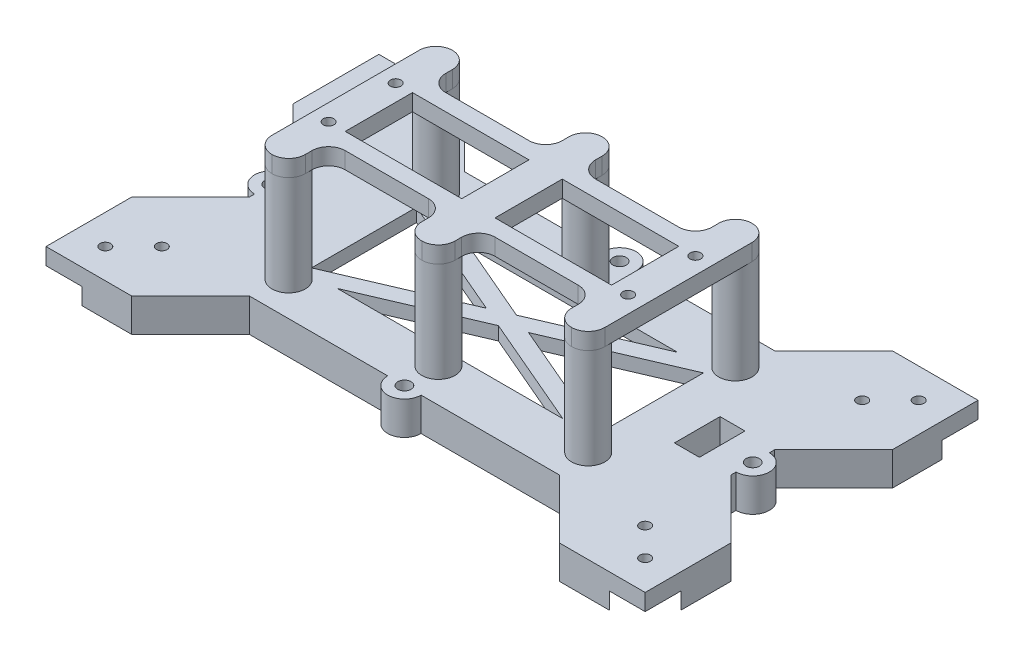
from build123d import *

# Parameters (mm, degrees)
SKETCH_1_W           = 90
SKETCH_1_H           = 50
EXTRUDE_1_DEPTH      = 10
CUT_EXTRUDE_2_DEPTH  = 5
SKETCH_7_R           = 1.6
CUT_EXTRUDE_3_DEPTH  = 10
MIRROR_3_DEPTH       = 10
MIRROR_START         = 5
MIRROR_3_2_OUTLINE_R = 1.6
MIRROR_3_2_DEPTH     = 5
SKETCH_8_R           = 5
EXTRUDE_2_DEPTH      = 30
SKETCH_10_W          = 35
SKETCH_10_H          = 20.2
EXTRUDE_6_DEPTH      = 5
SKETCH_11_W          = 102.2
SKETCH_11_H          = 51.5
CUT_EXTRUDE_4_DEPTH  = 6
SKETCH_12_W          = 7.5
SKETCH_12_H          = 13.7
CUT_EXTRUDE_5_DEPTH  = 50
FILLET_2_R           = 5
CUT_EXTRUDE_6_DEPTH  = 15
CUT_EXTRUDE_7_DEPTH  = 10
SKETCH_15_R          = 5
EXTRUDE_7_DEPTH      = 10
SKETCH_16_R          = 2
CUT_EXTRUDE_8_DEPTH  = 10
SKETCH_17_R          = 1.6
CUT_EXTRUDE_9_DEPTH  = 10


# Read off the part's stored shape, not the designer's step: Зеркальное отражение3
with BuildPart() as part:
    # Эскиз1 → Бобышка-Вытянуть1 (new body)
    with BuildSketch(Plane(origin=(0, 0, 0), x_dir=(1, 0, 0), z_dir=(0, 1, 0))):
        with Locations((4.158751696, -0.305291723)):
            Rectangle(SKETCH_1_W, SKETCH_1_H)
    extrude(amount=EXTRUDE_1_DEPTH)

    # Эскиз2 → Вырез-Вытянуть2 (cut)
    with BuildSketch(Plane.XZ):
        Polygon((-40.841248304, 14.557268649), (-23.163578774, -3.12040088), (-12.4155557, 7.627622194), (-30.09322523, 25.305291723), (-40.841248304, 25.305291723), align=None)
    extrude(amount=-CUT_EXTRUDE_2_DEPTH, mode=Mode.SUBTRACT)

    # Эскиз7 → Вырез-Вытянуть3 (cut)
    with BuildSketch(Plane.XZ.offset(-5)):
        with Locations(Location((-31.931702861, 16.39574628, 0), (0, 0, 270))):
            Circle(SKETCH_7_R)
        with Locations(Location((-23.446421487, 7.910464906, 0), (0, 0, 270))):
            Circle(SKETCH_7_R)
    extrude(amount=-CUT_EXTRUDE_3_DEPTH, mode=Mode.SUBTRACT)

    # Зеркальное отражение3 outline → Зеркальное отражение3 (add)
    with BuildSketch(Plane(origin=(0, 0, 0), x_dir=(1, 0, 0), z_dir=(0, 1, 0))):
        Polygon((-40.841248304, 63.946685203), (-40.841248304, 24.694708277), (49.158751696, 24.694708277), (49.158751696, -25.305291723), (128.410728622, -25.305291723), (110.733059092, -7.627622194), (121.481082166, 3.12040088), (139.158751696, -14.557268649), (139.158751696, 63.946685203), (121.481082166, 46.269015673), (110.733059092, 57.017038747), (128.410728622, 74.694708277), (-30.09322523, 74.694708277), (-12.4155557, 57.017038747), (-23.163578774, 46.269015673), align=None)
    extrude(amount=MIRROR_3_DEPTH)

    # Mirror 3 2 outline → Mirror 3 2 (add)
    # profile 1 of 3: a face of its own
    with BuildSketch(Plane(origin=(0, 0, 0), x_dir=(1, 0, 0), z_dir=(0, 1, 0)).offset(MIRROR_START)):
        Polygon((-40.841248304, 74.694708277), (-40.841248304, 63.946685203), (-23.163578774, 46.269015673), (-12.4155557, 57.017038747), (-30.09322523, 74.694708277), align=None)
        with Locations((-23.446421487, 57.29988146)):
            Circle(MIRROR_3_2_OUTLINE_R, mode=Mode.SUBTRACT)
        with Locations((-31.931702861, 65.785162834)):
            Circle(MIRROR_3_2_OUTLINE_R, mode=Mode.SUBTRACT)
    # profile 2 of 3: a face of its own
    with BuildSketch(Plane(origin=(0, 0, 0), x_dir=(1, 0, 0), z_dir=(0, 1, 0)).offset(MIRROR_START)):
        Polygon((110.733059092, -7.627622194), (128.410728622, -25.305291723), (139.158751696, -25.305291723), (139.158751696, -14.557268649), (121.481082166, 3.12040088), align=None)
        with Locations((130.249206253, -16.39574628)):
            Circle(MIRROR_3_2_OUTLINE_R, mode=Mode.SUBTRACT)
        with Locations((121.763924879, -7.910464906)):
            Circle(MIRROR_3_2_OUTLINE_R, mode=Mode.SUBTRACT)
    # profile 3 of 3: a face of its own
    with BuildSketch(Plane(origin=(0, 0, 0), x_dir=(1, 0, 0), z_dir=(0, 1, 0)).offset(MIRROR_START)):
        Polygon((139.158751696, 74.694708277), (128.410728622, 74.694708277), (110.733059092, 57.017038747), (121.481082166, 46.269015673), (139.158751696, 63.946685203), align=None)
        with Locations((121.763924879, 57.29988146)):
            Circle(MIRROR_3_2_OUTLINE_R, mode=Mode.SUBTRACT)
        with Locations((130.249206253, 65.785162834)):
            Circle(MIRROR_3_2_OUTLINE_R, mode=Mode.SUBTRACT)
    extrude(amount=MIRROR_3_2_DEPTH)

    # Эскиз8 → Бобышка-Вытянуть2 (add)
    with BuildSketch(Plane(origin=(0, 10, 0), x_dir=(1, 0, 0), z_dir=(0, 1, 0))):
        with Locations(Location((49.158751696, 46.794708277, 0), (0, 0, 90))):
            Circle(SKETCH_8_R)
        with Locations(Location((94.158751696, 46.794708277, 0), (0, 0, 90))):
            Circle(SKETCH_8_R)
        with Locations(Location((94.158751696, 2.594708277, 0), (0, 0, 90))):
            Circle(SKETCH_8_R)
        with Locations(Location((4.158751696, 2.594708277, 0), (0, 0, 90))):
            Circle(SKETCH_8_R)
        with Locations(Location((49.158751696, 2.594708277, 0), (0, 0, 90))):
            Circle(SKETCH_8_R)
        with Locations(Location((4.158751696, 46.794708277, 0), (0, 0, 90))):
            Circle(SKETCH_8_R)
    extrude(amount=EXTRUDE_2_DEPTH)

    # Эскиз10 → Бобышка-Вытянуть6 (add)
    with BuildSketch(Plane(origin=(0, 40, 0), x_dir=(1, 0, 0), z_dir=(0, 1, 0))):
        Polygon((9.158751696, 51.794708277), (9.158751696, 39.794708277), (44.158751696, 39.794708277), (44.158751696, 51.794708277), (54.158751696, 51.794708277), (54.158751696, 39.794708277), (89.158751696, 39.794708277), (89.158751696, 51.794708277), (99.158751696, 51.794708277), (99.158751696, -2.405291723), (89.158751696, -2.405291723), (89.158751696, 9.594708277), (54.158751696, 9.594708277), (54.158751696, -2.405291723), (44.158751696, -2.405291723), (44.158751696, 9.594708277), (9.158751696, 9.594708277), (9.158751696, -2.405291723), (-0.841248304, -2.405291723), (-0.841248304, 51.794708277), align=None)
        with Locations((26.658751696, 24.694708277)):
            Rectangle(SKETCH_10_W, SKETCH_10_H, mode=Mode.SUBTRACT)
        with Locations((71.658751696, 24.694708277)):
            Rectangle(SKETCH_10_W, SKETCH_10_H, mode=Mode.SUBTRACT)
    extrude(amount=EXTRUDE_6_DEPTH)

    # Эскиз11 → Вырез-Вытянуть4 (cut)
    with BuildSketch(Plane(origin=(0, 0, 0), x_dir=(-1, 0, 0), z_dir=(0, -1, 0))):
        with Locations((-47.698520167, 25.294708277)):
            Rectangle(SKETCH_11_W, SKETCH_11_H)
    extrude(amount=-CUT_EXTRUDE_4_DEPTH, mode=Mode.SUBTRACT)

    # Эскиз12 → Вырез-Вытянуть5 (cut)
    with BuildSketch(Plane(origin=(0, 10, 0), x_dir=(1, 0, 0), z_dir=(0, 1, 0))):
        with Locations((108.408751696, 24.844708277)):
            Rectangle(SKETCH_12_W, SKETCH_12_H)
    extrude(amount=-CUT_EXTRUDE_5_DEPTH, mode=Mode.SUBTRACT)

    # Скругление2
    fillet_2_edges = [part.edges().sort_by_distance(p)[0] for p in [
        (54.158751696, 42.5, -9.594708277),
        (9.158751696, 42.5, -9.594708277),
        (-0.841248304, 42.5, 2.405291723),
        (9.158751696, 42.5, 2.405291723),
        (44.158751696, 42.5, -9.594708277),
        (54.158751696, 42.5, 2.405291723),
        (44.158751696, 42.5, 2.405291723),
        (89.158751696, 42.5, -9.594708277),
        (89.158751696, 42.5, 2.405291723),
        (99.158751696, 42.5, 2.405291723),
        (54.158751696, 42.5, -39.794708277),
        (9.158751696, 42.5, -39.794708277),
        (44.158751696, 42.5, -39.794708277),
        (99.158751696, 42.5, -51.794708277),
        (89.158751696, 42.5, -39.794708277),
        (89.158751696, 42.5, -51.794708277),
        (54.158751696, 42.5, -51.794708277),
        (44.158751696, 42.5, -51.794708277),
        (9.158751696, 42.5, -51.794708277),
        (-0.841248304, 42.5, -51.794708277),
    ]]
    fillet(fillet_2_edges, radius=FILLET_2_R - 0.0001)  # a hair under: the kernel refuses the full size

    # Эскиз13 → Вырез-Вытянуть6 (cut)
    with BuildSketch(Plane.XZ):
        Polygon((-15.09322523, 25.305291723), (2.5844443, 7.627622194), (95.733059092, 7.627622194), (113.410728622, 25.305291723), align=None)
        Polygon((-40.841248304, -0.442731351), (-23.163578774, -18.12040088), (-23.163578774, -31.269015673), (-40.841248304, -48.946685203), align=None)
        Polygon((-15.09322523, -74.694708277), (2.5844443, -57.017038747), (95.733059092, -57.017038747), (113.410728622, -74.694708277), align=None)
        Polygon((139.158751696, -0.442731351), (121.481082166, -18.12040088), (121.481082166, -31.269015673), (139.158751696, -48.946685203), align=None)
    extrude(amount=-CUT_EXTRUDE_6_DEPTH, mode=Mode.SUBTRACT)

    # Эскиз14 → Вырез-Вытянуть7 (cut)
    with BuildSketch(Plane.XZ.offset(-6)):
        Polygon((4.598520167, -9.023164144), (4.598520167, -40.56625241), (41.357986916, -24.794708277), align=None)
        Polygon((13.833681258, -7.544708277), (47.698520167, -22.074320609), (81.563359076, -7.544708277), align=None)
        Polygon((13.833681258, -42.044708277), (47.698520167, -27.515095944), (81.563359076, -42.044708277), align=None)
        Polygon((54.039053419, -24.794708277), (90.798520167, -40.56625241), (90.798520167, -9.023164144), align=None)
    extrude(amount=-CUT_EXTRUDE_7_DEPTH, mode=Mode.SUBTRACT)

    # Эскиз15 → Бобышка-Вытянуть7 (add)
    with BuildSketch(Plane.XZ):
        with Locations((49.158751696, 7.627622194)):
            Circle(SKETCH_15_R)
        with Locations((-23.163578774, -24.694708277)):
            Circle(SKETCH_15_R)
        with Locations((121.481082166, -24.694708277)):
            Circle(SKETCH_15_R)
        with Locations((49.158751696, -57.017038747)):
            Circle(SKETCH_15_R)
    extrude(amount=-EXTRUDE_7_DEPTH)

    # Эскиз16 → Вырез-Вытянуть8 (cut)
    with BuildSketch(Plane.XZ):
        with Locations(Location((49.158751696, 7.627622194, 0), (0, 0, 270))):
            Circle(SKETCH_16_R)
        with Locations(Location((-23.163578774, -24.694708277, 0), (0, 0, 270))):
            Circle(SKETCH_16_R)
        with Locations(Location((121.481082166, -24.694708277, 0), (0, 0, 270))):
            Circle(SKETCH_16_R)
        with Locations(Location((49.158751696, -57.017038747, 0), (0, 0, 270))):
            Circle(SKETCH_16_R)
    extrude(amount=-CUT_EXTRUDE_8_DEPTH, mode=Mode.SUBTRACT)

    # Эскиз17 → Вырез-Вытянуть9 (cut)
    with BuildSketch(Plane(origin=(0, 45, 0), x_dir=(1, 0, 0), z_dir=(0, 1, 0))):
        with Locations(Location((4.158751696, 34.74175422, 0), (0, 0, 270))):
            Circle(SKETCH_17_R)
        with Locations(Location((94.158751696, 34.794708277, 0), (0, 0, 270))):
            Circle(SKETCH_17_R)
        with Locations(Location((94.158751696, 14.594708277, 0), (0, 0, 270))):
            Circle(SKETCH_17_R)
        with Locations(Location((4.158751696, 14.594708277, 0), (0, 0, 270))):
            Circle(SKETCH_17_R)
    extrude(amount=-CUT_EXTRUDE_9_DEPTH, mode=Mode.SUBTRACT)


solid = part.part
